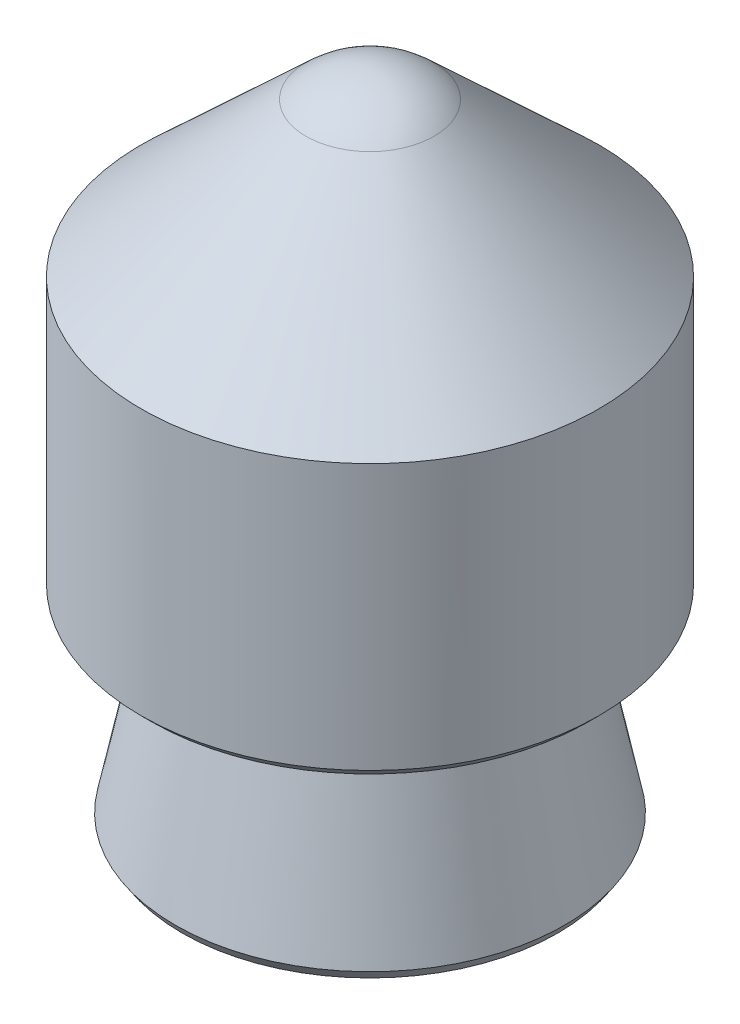
from build123d import *
from OCP.BRepFilletAPI import BRepFilletAPI_MakeChamfer

# Parameters (mm, degrees)
CHAMFER1_SIZE              = 0.254
CHAMFER1_SIZE2             = 0.215388858
SKETCH4_R                  = 3.5
CUT_EXTRUDE1_DEPTH         = 2.5
M7X0_75_TAPPED_HOLE1_D     = 6
M7X0_75_TAPPED_HOLE1_DEPTH = 10.954004
M7X0_75_TAPPED_HOLE1_TIP   = 1.802581857


with BuildPart() as part:
    # Sketch1 → Revolve1 (revolve)
    with BuildSketch(Plane.XY):
        with BuildLine():
            Line((0, 25.4), (-4.80695, 25.4))
            Line((-4.80695, 25.4), (-3.8227, 30.2387))
            Line((-3.8227, 30.2387), (-5.588, 30.2387))
            Line((-5.588, 30.2387), (-5.588, 36.9824))
            Line((-5.588, 36.9824), (-1.563367534, 40.735379295))
            ThreePointArc((-1.563367534, 40.735379295), (-0.840141831, 41.19169557), (0, 41.3512))
            Line((0, 41.3512), (0, 25.4))
        make_face()
    revolve(axis=Axis((0, 25.4, 0), (0, 1, 0)))

    # Chamfer1: one chamfer whose edges measure the first distance from different faces: ONE call of the kernel's chamfer builder (chamfer() names one face for all edges)
    chamfer1_edges_1 = [part.edges().sort_by_distance(p)[0] for p in [
        (4.80695, 25.4, 0),
    ]]
    chamfer1_side_1 = [part.faces().sort_by_distance(p)[0] for p in [
        (4.314825, 27.81935, 0),
    ]]
    chamfer1_edges_2 = [part.edges().sort_by_distance(p)[0] for p in [
        (5.588, 30.2387, 0),
    ]]
    chamfer1 = BRepFilletAPI_MakeChamfer(part.part.solid().wrapped)
    for e in chamfer1_edges_1:
        chamfer1.Add(CHAMFER1_SIZE, CHAMFER1_SIZE2, e.wrapped, chamfer1_side_1[0].wrapped)  # the first distance lies on this face
    for e in chamfer1_edges_2:
        chamfer1.Add(CHAMFER1_SIZE, e.wrapped)
    add(Compound.cast(chamfer1.Shape()), mode=Mode.REPLACE)

    # Sketch4 → Cut-Extrude1 (cut)
    with BuildSketch(Plane.XZ.offset(-25.4)):
        Circle(SKETCH4_R)
    extrude(amount=-CUT_EXTRUDE1_DEPTH, mode=Mode.SUBTRACT)

    # M7x0.75 Tapped Hole1
    with Locations(Plane(origin=(0, 25.4, 0), x_dir=(-1, 0, 0), z_dir=(0, -1, 0))):
        with Locations((0, 0), (96.139395676, -180.684699687)):
            Hole(M7X0_75_TAPPED_HOLE1_D / 2, depth=M7X0_75_TAPPED_HOLE1_DEPTH)
            with Locations((0, 0, -(M7X0_75_TAPPED_HOLE1_DEPTH + M7X0_75_TAPPED_HOLE1_TIP / 2))):  # 118° drill point
                Cone(0, M7X0_75_TAPPED_HOLE1_D / 2, M7X0_75_TAPPED_HOLE1_TIP, mode=Mode.SUBTRACT)


solid = part.part
